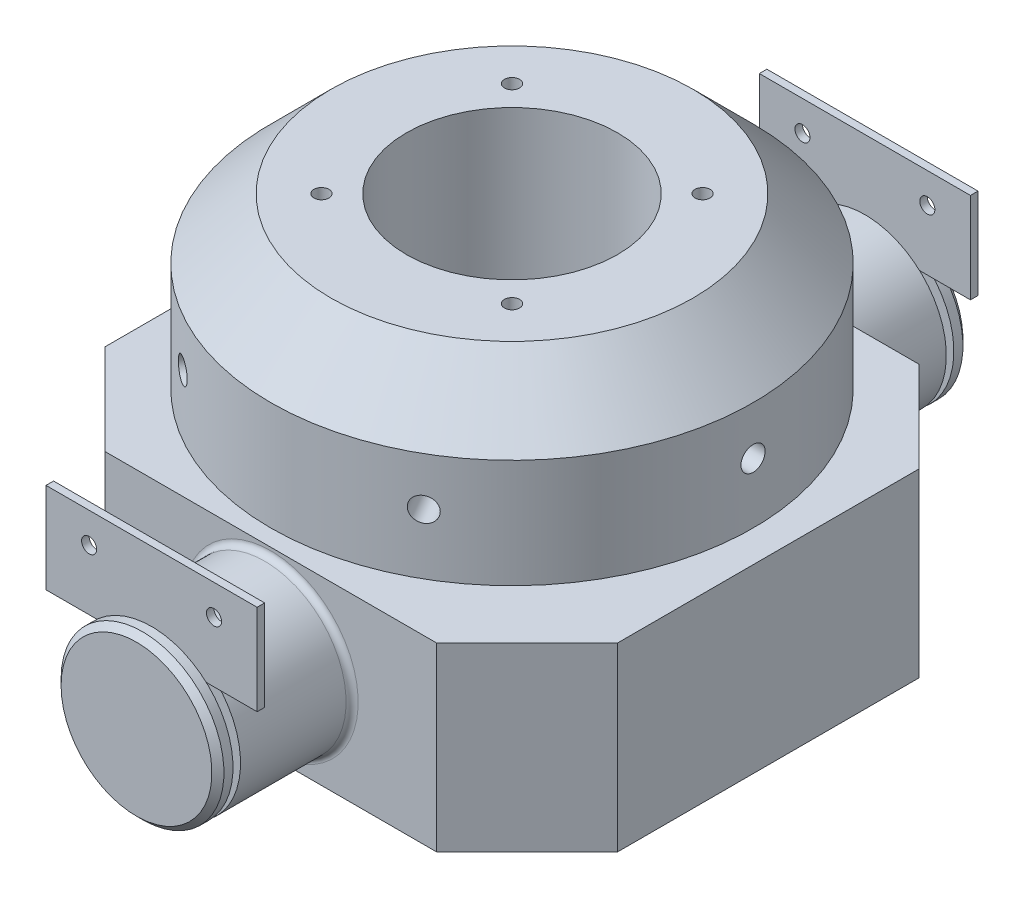
from build123d import *

# Parameters (mm, degrees)
MAIN_DEPTH                = 120
PERNO1_START              = 160
PERNO1_OUTLINE_R          = 54
PERNO1_DEPTH              = 74
PERNO1_2_OUTLINE_R        = 70
PERNO1_2_DEPTH            = 120
SANALATURAPERNO_START     = 234
SKETCH4_3_R               = 40
SANALATURAPERNO_DEPTH     = 5
PERNO2_START              = 239
SKETCH4_4_R               = 54
SKETCH4_4_R_2             = 40
PERNO2_DEPTH              = 10
CHAMFER1_SIZE             = 4
FILLET2_R                 = 4
CHAMFER1_OF_MIRROR14_SIZE = 4
FILLET2_OF_MIRROR14_R     = 4
CHAMFER2_SIZE             = 5
PISTA_R                   = 17
CIRPATTERN5_COUNT         = 22
CHAMFER3_SIZE             = 40
CIRPATTERN6_COUNT         = 6
CIRPATTERN7_COUNT         = 4
SKETCH11_W                = 70
SKETCH11_H                = 60
BOSS_EXTRUDE5_DEPTH       = 5
SKETCH12_R                = 5
CUT_EXTRUDE2_DEPTH        = 5


# Read off the part's stored shape, not the designer's step: Perno1
with BuildPart() as part:
    # MainBody → Main (new body)
    with BuildSketch(Plane(origin=(0, 0, 0), x_dir=(1, 0, 0), z_dir=(0, 1, 0))):
        Polygon((-110, 160), (110, 160), (170, 100), (170, -100), (110, -160), (-110, -160), (-170, -100), (-170, 100), align=None)
    extrude(amount=MAIN_DEPTH)

    # Perno1 outline → Perno1 (add)
    with BuildSketch(Plane.XY.offset(PERNO1_START)):
        with Locations((0, 60)):
            Circle(PERNO1_OUTLINE_R)
    perno1 = extrude(amount=PERNO1_DEPTH)

    # Perno1 2 outline → Perno1 2 (cut)
    with BuildSketch(Plane(origin=(0, 0, 0), x_dir=(1, 0, 0), z_dir=(0, 1, 0))):
        Circle(PERNO1_2_OUTLINE_R)
    perno1_2 = extrude(amount=PERNO1_2_DEPTH, mode=Mode.SUBTRACT)

    # Sketch4<3> → SanalaturaPerno (add)
    with BuildSketch(Plane.XY.offset(SANALATURAPERNO_START)):
        with Locations(Location((0, 60, 0), (0, 0, 180))):
            Circle(SKETCH4_3_R)
    sanalaturaperno = extrude(amount=SANALATURAPERNO_DEPTH)

    # Sketch4<4> → Perno2 (add)
    # profile 1 of 2: a face of its own
    with BuildSketch(Plane.XY.offset(PERNO2_START)):
        with Locations(Location((0, 60, 0), (0, 0, 180))):
            Circle(SKETCH4_4_R)
        with Locations(Location((0, 60, 0), (0, 0, 180))):
            Circle(SKETCH4_4_R_2, mode=Mode.SUBTRACT)
    # profile 2 of 2: a face of its own
    with BuildSketch(Plane.XY.offset(PERNO2_START)):
        with Locations(Location((0, 60, 0), (0, 0, 180))):
            Circle(SKETCH4_4_R_2)
    perno2 = extrude(amount=PERNO2_DEPTH)

    # Chamfer1
    chamfer1_edges = [part.edges().sort_by_distance(p)[0] for p in [
        (54, 60, 249),
    ]]
    chamfer(chamfer1_edges, length=CHAMFER1_SIZE)

    # Fillet2
    fillet2_edges = [part.edges().sort_by_distance(p)[0] for p in [
        (-54, 60, 160),
    ]]
    fillet(fillet2_edges, radius=FILLET2_R)

    # Mirror14: Perno1, Perno1 2, SanalaturaPerno, Perno2 across plane
    add(perno1.mirror(Plane.XY))
    add(perno1_2.mirror(Plane.XY), mode=Mode.SUBTRACT)
    add(sanalaturaperno.mirror(Plane.XY))
    add(perno2.mirror(Plane.XY))

    # Chamfer1 of Mirror14
    chamfer1_of_mirror14_edges = [part.edges().sort_by_distance(p)[0] for p in [
        (54, 60, -249),
    ]]
    chamfer(chamfer1_of_mirror14_edges, length=CHAMFER1_OF_MIRROR14_SIZE)

    # Fillet2 of Mirror14
    fillet2_of_mirror14_edges = [part.edges().sort_by_distance(p)[0] for p in [
        (-54, 60, -160),
    ]]
    fillet(fillet2_of_mirror14_edges, radius=FILLET2_OF_MIRROR14_R)

    # Chamfer2
    chamfer2_edges = [part.edges().sort_by_distance(p)[0] for p in [
        (-70, 0, 0),
    ]]
    chamfer(chamfer2_edges, length=CHAMFER2_SIZE)

    # Pista → PistaCut (revolve, cut)
    with BuildSketch(Plane.XY, mode=Mode.PRIVATE) as pistacut_sk:
        with Locations((106, 128)):
            Circle(PISTA_R)
    revolve(pistacut_sk.sketch.rotate(Axis((0, 120, 0), (0, -1, 0)), 90), axis=Axis((0, 120, 0), (0, -1, 0)), mode=Mode.SUBTRACT)


with BuildPart() as body_2:
    # Pista<4> → Sfera (revolve)
    with BuildSketch(Plane.XY):
        with BuildLine():
            Line((106, 111), (106, 140))
            ThreePointArc((106, 140), (120.5, 125.5), (106, 111))
        make_face()
    revolve(axis=Axis((106, 207.756618998, 0), (0, -1, 0)))


with BuildPart() as cirpattern5_1:
    # CirPattern5: pattern copy
    add(body_2.part.rotate(Axis((0, 0, 0), (0, 1, 0)), 1 * 360 / CIRPATTERN5_COUNT))


with BuildPart() as cirpattern5_2:
    # CirPattern5: pattern copy
    add(body_2.part.rotate(Axis((0, 0, 0), (0, 1, 0)), 2 * 360 / CIRPATTERN5_COUNT))


with BuildPart() as cirpattern5_3:
    # CirPattern5: pattern copy
    add(body_2.part.rotate(Axis((0, 0, 0), (0, 1, 0)), 3 * 360 / CIRPATTERN5_COUNT))


with BuildPart() as cirpattern5_4:
    # CirPattern5: pattern copy
    add(body_2.part.rotate(Axis((0, 0, 0), (0, 1, 0)), 4 * 360 / CIRPATTERN5_COUNT))


with BuildPart() as cirpattern5_5:
    # CirPattern5: pattern copy
    add(body_2.part.rotate(Axis((0, 0, 0), (0, 1, 0)), 5 * 360 / CIRPATTERN5_COUNT))


with BuildPart() as cirpattern5_6:
    # CirPattern5: pattern copy
    add(body_2.part.rotate(Axis((0, 0, 0), (0, 1, 0)), 6 * 360 / CIRPATTERN5_COUNT))


with BuildPart() as cirpattern5_7:
    # CirPattern5: pattern copy
    add(body_2.part.rotate(Axis((0, 0, 0), (0, 1, 0)), 7 * 360 / CIRPATTERN5_COUNT))


with BuildPart() as cirpattern5_8:
    # CirPattern5: pattern copy
    add(body_2.part.rotate(Axis((0, 0, 0), (0, 1, 0)), 8 * 360 / CIRPATTERN5_COUNT))


with BuildPart() as cirpattern5_9:
    # CirPattern5: pattern copy
    add(body_2.part.rotate(Axis((0, 0, 0), (0, 1, 0)), 9 * 360 / CIRPATTERN5_COUNT))


with BuildPart() as cirpattern5_10:
    # CirPattern5: pattern copy
    add(body_2.part.rotate(Axis((0, 0, 0), (0, 1, 0)), 10 * 360 / CIRPATTERN5_COUNT))


with BuildPart() as cirpattern5_11:
    # CirPattern5: pattern copy
    add(body_2.part.rotate(Axis((0, 0, 0), (0, 1, 0)), 11 * 360 / CIRPATTERN5_COUNT))


with BuildPart() as cirpattern5_12:
    # CirPattern5: pattern copy
    add(body_2.part.rotate(Axis((0, 0, 0), (0, 1, 0)), 12 * 360 / CIRPATTERN5_COUNT))


with BuildPart() as cirpattern5_13:
    # CirPattern5: pattern copy
    add(body_2.part.rotate(Axis((0, 0, 0), (0, 1, 0)), 13 * 360 / CIRPATTERN5_COUNT))


with BuildPart() as cirpattern5_14:
    # CirPattern5: pattern copy
    add(body_2.part.rotate(Axis((0, 0, 0), (0, 1, 0)), 14 * 360 / CIRPATTERN5_COUNT))


with BuildPart() as cirpattern5_15:
    # CirPattern5: pattern copy
    add(body_2.part.rotate(Axis((0, 0, 0), (0, 1, 0)), 15 * 360 / CIRPATTERN5_COUNT))


with BuildPart() as cirpattern5_16:
    # CirPattern5: pattern copy
    add(body_2.part.rotate(Axis((0, 0, 0), (0, 1, 0)), 16 * 360 / CIRPATTERN5_COUNT))


with BuildPart() as cirpattern5_17:
    # CirPattern5: pattern copy
    add(body_2.part.rotate(Axis((0, 0, 0), (0, 1, 0)), 17 * 360 / CIRPATTERN5_COUNT))


with BuildPart() as cirpattern5_18:
    # CirPattern5: pattern copy
    add(body_2.part.rotate(Axis((0, 0, 0), (0, 1, 0)), 18 * 360 / CIRPATTERN5_COUNT))


with BuildPart() as cirpattern5_19:
    # CirPattern5: pattern copy
    add(body_2.part.rotate(Axis((0, 0, 0), (0, 1, 0)), 19 * 360 / CIRPATTERN5_COUNT))


with BuildPart() as cirpattern5_20:
    # CirPattern5: pattern copy
    add(body_2.part.rotate(Axis((0, 0, 0), (0, 1, 0)), 20 * 360 / CIRPATTERN5_COUNT))


with BuildPart() as cirpattern5_21:
    # CirPattern5: pattern copy
    add(body_2.part.rotate(Axis((0, 0, 0), (0, 1, 0)), 21 * 360 / CIRPATTERN5_COUNT))


with BuildPart() as body_24:
    # Sketch6 → Revolve7 (revolve)
    with BuildSketch(Plane(origin=(0, 0, 0), x_dir=(0, 0, -1), z_dir=(1, 0, 0)), mode=Mode.PRIVATE) as revolve7_sk:
        with BuildLine():
            Line((70, 131), (91, 131))
            ThreePointArc((91, 131), (106, 140), (121, 131))
            Line((121, 131), (160, 131))
            Line((160, 131), (160, 243))
            Line((160, 243), (70, 243))
            Line((70, 243), (70, 131))
        make_face()
    revolve(revolve7_sk.sketch.rotate(Axis((0, 120, 0), (0, -1, 0)), 180), axis=Axis((0, 120, 0), (0, -1, 0)))

    # Chamfer3
    chamfer3_edges = [body_24.edges().sort_by_distance(p)[0] for p in [
        (0, 243, -160),
    ]]
    chamfer(chamfer3_edges, length=CHAMFER3_SIZE)

    # Sketch7 → ForiAvvitamento (revolve, cut)
    with BuildSketch(Plane.XY, mode=Mode.PRIVATE) as foriavvitamento_sk:
        Polygon((-163.134253855, 179), (-163.134253855, 171), (-98.515451701, 171), (-103.134253855, 179), align=None)
    foriavvitamento = revolve(foriavvitamento_sk.sketch.rotate(Axis((-163.134253855, 171, 0), (1, 0, 0)), 90), axis=Axis((-163.134253855, 171, 0), (1, 0, 0)), mode=Mode.SUBTRACT)

    # CirPattern6: ForiAvvitamento ×6 about axis
    cirpattern6_axis = Axis((0, 120, 0), (0, -1, 0))
    for i in range(1, CIRPATTERN6_COUNT):
        add(foriavvitamento.rotate(cirpattern6_axis, i * 360 / CIRPATTERN6_COUNT), mode=Mode.SUBTRACT)


with BuildPart() as cut_revolve2_tool:
    # Sketch8 → Cut-Revolve2 (revolve)
    with BuildSketch(Plane(origin=(0, 0, 0), x_dir=(0, 0, -1), z_dir=(1, 0, 0))):
        Polygon((-136, 141), (-136, 131), (-136, 120), (-136, 110), (-130, 110), (-130, 120), (-130, 131), (-130, 141), align=None)
    revolve(axis=Axis((0, 120, 0), (0, -1, 0)))


with BuildPart() as part_1:
    add(part.part)

    # Cut-Revolve2: cut by cut_revolve2_tool
    add(cut_revolve2_tool.part, mode=Mode.SUBTRACT)


with BuildPart() as body_24_1:
    add(body_24.part)

    # Cut-Revolve2: cut by cut_revolve2_tool
    add(cut_revolve2_tool.part, mode=Mode.SUBTRACT)

    # ForoPiastrina → Cut-Revolve3 (revolve, cut)
    with BuildSketch(Plane(origin=(0, 0, 0), x_dir=(-0.7071067811865273, 0, -0.7071067811865679), z_dir=(0.7071067811865679, 0, -0.7071067811865273)), mode=Mode.PRIVATE) as cut_revolve3_sk:
        Polygon((89.349774909, 243), (84.349774909, 243), (84.349774909, 223), (89.349774909, 220.113248654), (89.349774909, 223), align=None)
    cut_revolve3 = revolve(cut_revolve3_sk.sketch.rotate(Axis((-63.179831736, 223, -63.179831736), (0, 1, 0)), 135), axis=Axis((-63.179831736, 223, -63.179831736), (0, 1, 0)), mode=Mode.SUBTRACT)

    # CirPattern7: Cut-Revolve3 ×4 about axis
    cirpattern7_axis = Axis((0, 0, 0), (0, 1, 0))
    for i in range(1, CIRPATTERN7_COUNT):
        add(cut_revolve3.rotate(cirpattern7_axis, i * 360 / CIRPATTERN7_COUNT), mode=Mode.SUBTRACT)


with BuildPart() as body_25:
    # Sketch11 → Boss-Extrude5 (new body)
    with BuildSketch(Plane.XY.offset(234)):
        with Locations((35, 130)):
            Rectangle(SKETCH11_W, SKETCH11_H)
    extrude(amount=BOSS_EXTRUDE5_DEPTH)

    # Sketch12 → Cut-Extrude2 (cut)
    with BuildSketch(Plane.XY.offset(239)):
        with Locations((41.39915115, 139.975628399)):
            Circle(SKETCH12_R)
    extrude(amount=-CUT_EXTRUDE2_DEPTH, mode=Mode.SUBTRACT)

    # Mirror15: body 25 across plane


with BuildPart() as body_25_1:
    add(body_25.part)
    add(body_25.part.mirror(Plane(origin=(0, 160, 239), x_dir=(0, 0, 1), z_dir=(1, 0, 0))))


with BuildPart() as body_26:
    # Mirror17: mirrored copy
    add(body_25_1.part.mirror(Plane.XY))


solid = Compound([body_2.part, cirpattern5_1.part, cirpattern5_2.part, cirpattern5_3.part, cirpattern5_4.part, cirpattern5_5.part, cirpattern5_6.part, cirpattern5_7.part, cirpattern5_8.part, cirpattern5_9.part, cirpattern5_10.part, cirpattern5_11.part, cirpattern5_12.part, cirpattern5_13.part, cirpattern5_14.part, cirpattern5_15.part, cirpattern5_16.part, cirpattern5_17.part, cirpattern5_18.part, cirpattern5_19.part, cirpattern5_20.part, cirpattern5_21.part, part_1.part, body_24_1.part, body_25_1.part, body_26.part])
